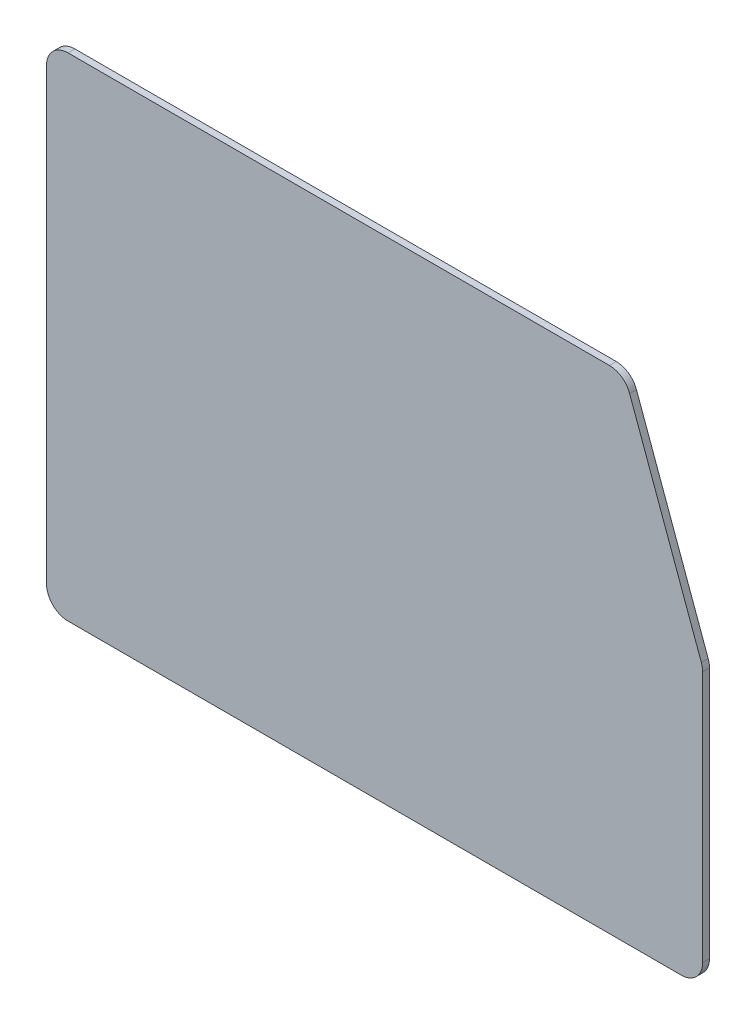
from build123d import *

# Parameters (mm, degrees)
BOSS_EXTRUDE1_DEPTH = 3.175
FILLET1_R           = 10


with BuildPart() as part:
    # Sketch1 → Boss-Extrude1 (new body)
    with BuildSketch(Plane.XY):
        Polygon((-62.034734806, 309.144369237), (206.435304788, 309.144369237), (242.765265194, 209.328623372), (242.765265194, 80.544369237), (-62.034734806, 80.544369237), align=None)
    extrude(amount=BOSS_EXTRUDE1_DEPTH)

    # Fillet1
    fillet1_edges = [part.edges().sort_by_distance(p)[0] for p in [
        (242.765265194, 80.544369237, 1.5875),
        (242.765265194, 209.328623372, 1.5875),
        (206.435304788, 309.144369237, 1.5875),
        (-62.034734806, 80.544369237, 1.5875),
        (-62.034734806, 309.144369237, 1.5875),
    ]]
    fillet(fillet1_edges, radius=FILLET1_R)


solid = part.part
